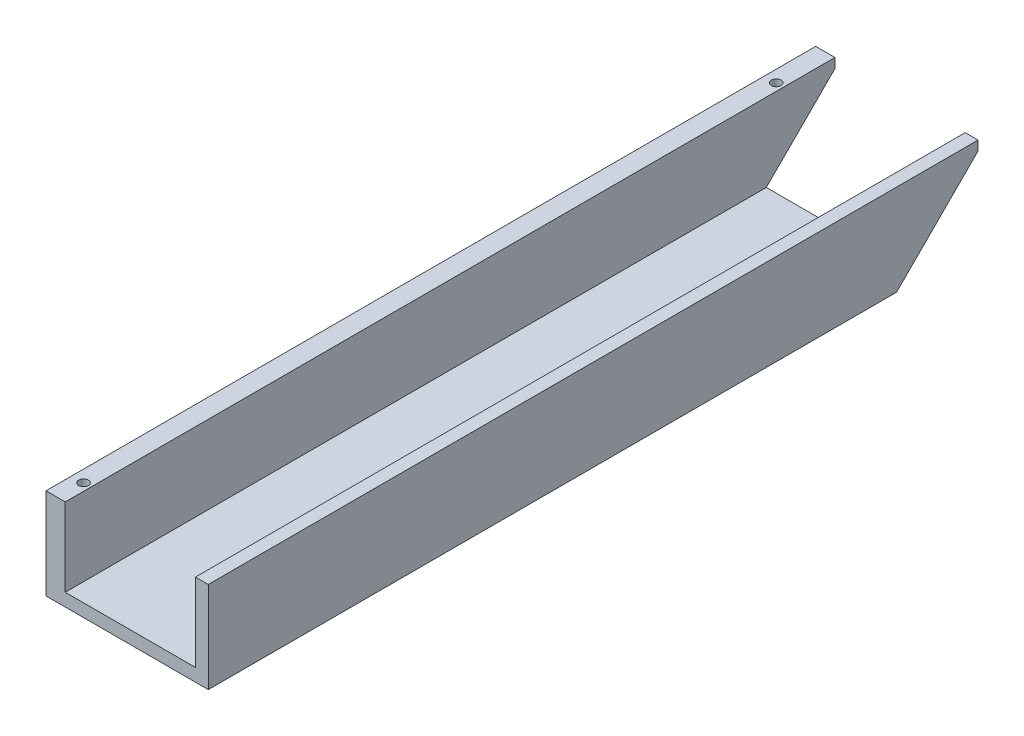
from build123d import *

# Parameters (mm, degrees)
RAIL_EXTRUDE_DEPTH = 120
SKETCH2_R          = 0.75
FIRST_HOLE_DEPTH   = 123.068100465
SKETCH3_R          = 0.75
LAST_HOLE_DEPTH    = 123.068100465
ANGLE_DEPTH        = 123.862392953


with BuildPart() as part:
    # Sketch1 → Rail-Extrude (new body)
    with BuildSketch(Plane.XY):
        Polygon((-8.008928571, 6.778571429), (-5.008928571, 6.778571429), (-5.008928571, -5.421428571), (15.291071429, -5.421428571), (15.291071429, 6.778571429), (17.291071429, 6.778571429), (17.291071429, -7.421428571), (-8.008928571, -7.421428571), align=None)
    extrude(amount=RAIL_EXTRUDE_DEPTH)

    # Sketch2 → First Hole (cut, through all)
    with BuildSketch(Plane(origin=(0, 6.778571429, 0), x_dir=(1, 0, 0), z_dir=(0, 1, 0))):
        with Locations((-6.158928571, -8)):
            Circle(SKETCH2_R)
    extrude(amount=-FIRST_HOLE_DEPTH, mode=Mode.SUBTRACT)

    # Sketch3 → Last Hole (cut, through all)
    with BuildSketch(Plane(origin=(0, 6.778571429, 0), x_dir=(1, 0, 0), z_dir=(0, 1, 0))):
        with Locations((-6.158928571, -116)):
            Circle(SKETCH3_R)
    extrude(amount=-LAST_HOLE_DEPTH, mode=Mode.SUBTRACT)

    # Sketch5 → Angle (cut, through all)
    with BuildSketch(Plane.ZY.offset(8.008928571)):
        Polygon((12.7, -7.421428571), (0, 5.278571429), (0, -7.421428571), align=None)
    extrude(amount=-ANGLE_DEPTH, mode=Mode.SUBTRACT)


solid = part.part
